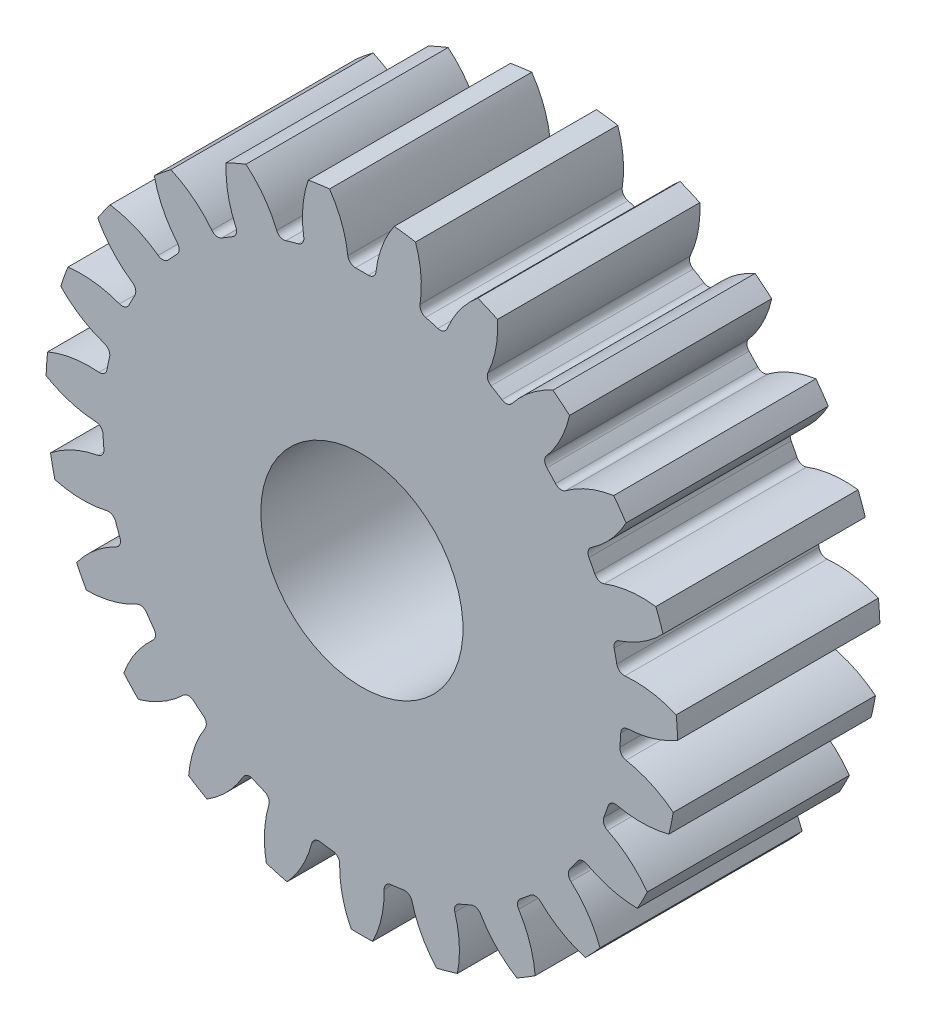
from build123d import *

# Parameters (mm, degrees)
SKETCH2_R                = 15.625
BOSS_EXTRUDE1_DEPTH      = 5
CUT_EXTRUDE1_DEPTH       = 23.6557112
FILLET1_R                = 0.375
CIRPATTERN1_COUNT        = 23
FILLET1_OF_CIRPATTERN1_R = 0.375
SKETCH4_R                = 5
CUT_EXTRUDE3_DEPTH       = 10


with BuildPart() as part:
    # Sketch2 → Boss-Extrude1 (new, symmetric)
    with BuildSketch(Plane.XY):
        Circle(SKETCH2_R)
    extrude(amount=BOSS_EXTRUDE1_DEPTH, both=True)

    # Sketch3 → Cut-Extrude1 (cut, symmetric)
    with BuildSketch(Plane.XY):
        with BuildLine():
            ThreePointArc((0.666625055, 12.795146239), (0, 12.8125), (-0.666625055, 12.795146239))
            ThreePointArc((-0.666625055, 12.795146239), (-0.943066669, 14.233732128), (-1.600537264, 15.542808802))
            ThreePointArc((-1.600537264, 15.542808802), (0, 15.625), (1.600537264, 15.542808802))
            ThreePointArc((1.600537264, 15.542808802), (0.943066669, 14.233732128), (0.666625055, 12.795146239))
        make_face()
    cut_extrude1 = extrude(amount=CUT_EXTRUDE1_DEPTH, both=True, mode=Mode.SUBTRACT)

    # Fillet1
    fillet1_edges = [part.edges().sort_by_distance(p)[0] for p in [
        (0.666625055, 12.795146239, 0),
        (-0.666625055, 12.795146239, 0),
    ]]
    fillet(fillet1_edges, radius=FILLET1_R)

    # CirPattern1: Cut-Extrude1 ×23 about axis
    cirpattern1_axis = Axis((0, 0, -11), (0, 0, 1))
    for i in range(1, CIRPATTERN1_COUNT):
        add(cut_extrude1.rotate(cirpattern1_axis, i * 360 / CIRPATTERN1_COUNT), mode=Mode.SUBTRACT)

    # Fillet1 of CirPattern1
    fillet1_of_cirpattern1_edges = [part.edges().sort_by_distance(p)[0] for p in [
        (-2.810184352, 12.500520795, 0),
        (-4.093993932, 12.140814221, 0),
        (-6.078575242, 11.27878891, 0),
        (-7.217730007, 10.586053552, 0),
        (-8.896146013, 9.220560849, 0),
        (-9.806160067, 8.246173719, 0),
        (-11.053930332, 6.47848597, 0),
        (-11.667312094, 5.294712905, 0),
        (-12.391895207, 3.255931424, 0),
        (-12.663152958, 1.950567456, 0),
        (-12.810809903, -0.208100661, 0),
        (-12.719825698, -1.538242657, 0),
        (-12.279605434, -3.656698871, 0),
        (-11.833127154, -4.912968349, 0),
        (-10.837678806, -6.834096455, 0),
        (-10.068819703, -7.923321655, 0),
        (-8.591971119, -9.504640368, 0),
        (-7.557753956, -10.34603844, 0),
        (-5.709036241, -11.470268587, 0),
        (-4.486164172, -12.001436884, 0),
        (-2.402688261, -12.585199457, 0),
        (-1.081856115, -12.766743657, 0),
        (1.081856115, -12.766743657, 0),
        (2.402688261, -12.585199457, 0),
        (4.486164172, -12.001436884, 0),
        (5.709036241, -11.470268587, 0),
        (7.557753956, -10.34603844, 0),
        (8.591971119, -9.504640368, 0),
        (10.068819703, -7.923321655, 0),
        (10.837678806, -6.834096455, 0),
        (11.833127154, -4.912968349, 0),
        (12.279605434, -3.656698871, 0),
        (12.719825698, -1.538242657, 0),
        (12.810809903, -0.208100661, 0),
        (12.663152958, 1.950567456, 0),
        (12.391895207, 3.255931424, 0),
        (11.667312094, 5.294712905, 0),
        (11.053930332, 6.47848597, 0),
        (9.806160067, 8.246173719, 0),
        (8.896146013, 9.220560849, 0),
        (7.217730007, 10.586053552, 0),
        (6.078575242, 11.27878891, 0),
        (4.093993932, 12.140814221, 0),
        (2.810184352, 12.500520795, 0),
    ]]
    fillet(fillet1_of_cirpattern1_edges, radius=FILLET1_OF_CIRPATTERN1_R)

    # Sketch4 → Cut-Extrude3 (cut)
    with BuildSketch(Plane(origin=(0, 0, -5), x_dir=(-1, 0, 0), z_dir=(0, 0, -1))):
        Circle(SKETCH4_R)
    extrude(amount=-CUT_EXTRUDE3_DEPTH, mode=Mode.SUBTRACT)


solid = part.part
